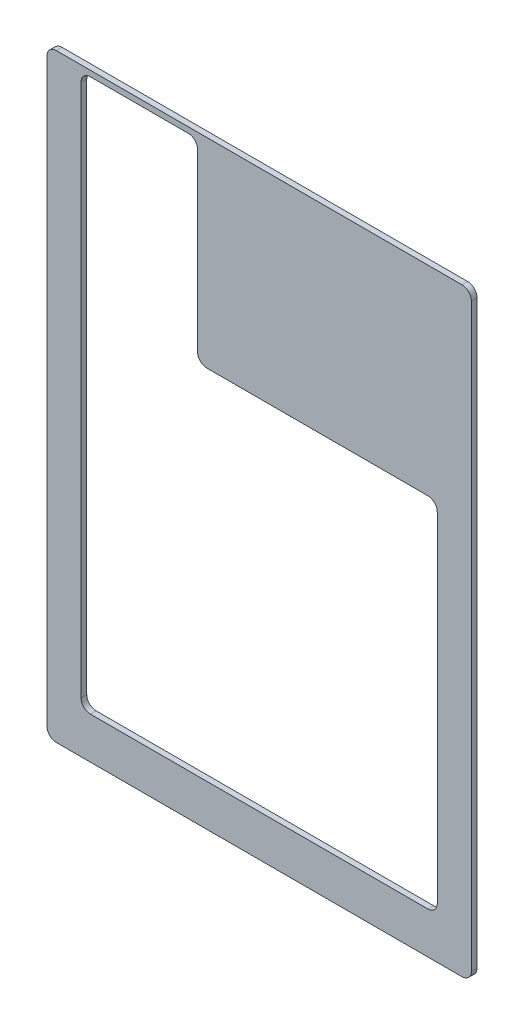
from build123d import *

# Parameters (mm, degrees)
SKETCH1_W           = 323.85
SKETCH1_H           = 457.2
BOSS_EXTRUDE1_DEPTH = 4.3434
SKETCH2_W           = 271.78
SKETCH2_H           = 273.05
CUT_EXTRUDE1_DEPTH  = 281.172323309
FILLET1_R           = 7.14375
SKETCH4_W           = 88.9
SKETCH4_H           = 184.911324328
CUT_EXTRUDE3_DEPTH  = 281.172323309
FILLET2_R           = 7.14375


with BuildPart() as part:
    # Sketch1 → Boss-Extrude1 (new body)
    with BuildSketch(Plane.XY):
        Rectangle(SKETCH1_W, SKETCH1_H)
    extrude(amount=BOSS_EXTRUDE1_DEPTH)

    # Sketch2 → Cut-Extrude1 (cut, through all)
    with BuildSketch(Plane.XY.offset(4.3434)):
        with Locations((0, -60.325)):
            Rectangle(SKETCH2_W, SKETCH2_H)
    extrude(amount=-CUT_EXTRUDE1_DEPTH, mode=Mode.SUBTRACT)

    # Fillet1
    fillet1_edges = [part.edges().sort_by_distance(p)[0] for p in [
        (135.89, -196.85, 2.1717),
        (135.89, 76.2, 2.1717),
        (-135.89, 76.2, 2.1717),
        (-135.89, -196.85, 2.1717),
        (-161.925, -228.6, 2.1717),
        (161.925, -228.6, 2.1717),
        (161.925, 228.6, 2.1717),
        (-161.925, 228.6, 2.1717),
    ]]
    fillet(fillet1_edges, radius=FILLET1_R)

    # Sketch4 → Cut-Extrude3 (cut, through all)
    with BuildSketch(Plane.XY.offset(4.3434)):
        with Locations((-91.44, 131.800937836)):
            Rectangle(SKETCH4_W, SKETCH4_H)
    extrude(amount=-CUT_EXTRUDE3_DEPTH, mode=Mode.SUBTRACT)

    # Fillet2
    fillet2_edges = [part.edges().sort_by_distance(p)[0] for p in [
        (-46.99, 76.2, 2.1717),
        (-46.99, 224.2566, 2.1717),
        (-135.89, 224.2566, 2.1717),
    ]]
    fillet(fillet2_edges, radius=FILLET2_R)


solid = part.part
